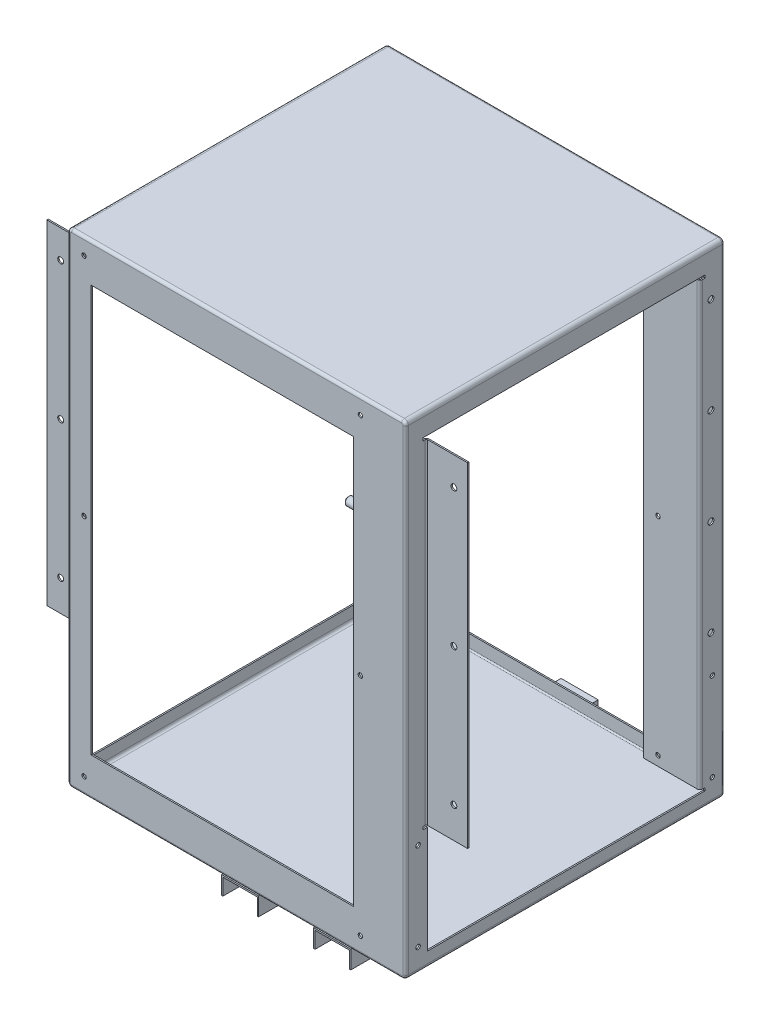
from build123d import *

# Parameters (mm, degrees)
EXTRUDE_1_DEPTH             = 232
SKETCH_2_W                  = 200
SKETCH_2_H                  = 325
CUT_EXTRUDE_1_DEPTH         = 500
EXTRUDE_START               = -1
EXTRUDE_1_2_DEPTH           = 1
SKETCH_4_W                  = 214
SKETCH_4_H                  = 325
EXTRUDE_2_DEPTH             = 1
FILLET_1_R                  = 1
FILLET_2_R                  = 2
SKETCH_5_R                  = 2.15
CUT_EXTRUDE_2_DEPTH         = 500
SKETCH_6_R                  = 3
EXTRUDE_3_DEPTH             = 20
CHAMFER_1_SIZE              = 1
SKETCH_7_R                  = 1.6
CUT_EXTRUDE_3_DEPTH         = 500
SKETCH_8_W                  = 191
SKETCH_8_H                  = 296
CUT_EXTRUDE_4_DEPTH         = 2
SKETCH_9_R                  = 1.6
CUT_EXTRUDE_5_DEPTH         = 2
EXTRUDE_6_REACH             = 396.406
EXTRUDE_6_DIRECTION_2_DEPTH = 15
SKETCH_11_W                 = 1
SKETCH_11_H                 = 243
EXTRUDE_7_DEPTH             = 30
SKETCH_12_W                 = 3.5
SKETCH_12_H                 = 2
CUT_EXTRUDE_6_DEPTH         = 20
SKETCH_13_W                 = 1
SKETCH_13_H                 = 243
EXTRUDE_8_DEPTH             = 30
SKETCH_14_R                 = 2.15
CUT_EXTRUDE_7_DEPTH         = 30
SKETCH_16_W                 = 1
SKETCH_16_H                 = 325
EXTRUDE_9_DEPTH             = 2
SKETCH_17_W                 = 1
SKETCH_17_H                 = 321
EXTRUDE_10_DEPTH            = 40
SKETCH_18_W                 = 1
SKETCH_18_H                 = 321
EXTRUDE_11_DEPTH            = 40
SKETCH_19_W                 = 3.5
SKETCH_19_H                 = 2
CUT_EXTRUDE_8_DEPTH         = 40
SKETCH_20_R                 = 1.6
CUT_EXTRUDE_9_DEPTH         = 10
SKETCH_21_R                 = 2.15
CUT_EXTRUDE_10_DEPTH        = 10
FILLET_3_R                  = 1
FILLET_4_R                  = 2
SKETCH_22_W                 = 4.75100146
SKETCH_22_H                 = 2.010828375
SKETCH_22_W_2               = 3.5
SKETCH_22_H_2               = 2
CUT_EXTRUDE_11_DEPTH        = 10


with BuildPart() as part:
    # Эскиз1 → Extrude 1 (new body)
    with BuildSketch(Plane.XY):
        with BuildLine():
            Line((123, -173), (123, 173))
            ThreePointArc((123, 173), (122.121320344, 175.121320344), (120, 176))
            Line((120, 176), (-120, 176))
            ThreePointArc((-120, 176), (-122.121320344, 175.121320344), (-123, 173))
            Line((-123, 173), (-123, -173))
            ThreePointArc((-123, -173), (-122.121320344, -175.121320344), (-120, -176))
            Line((-120, -176), (120, -176))
            ThreePointArc((120, -176), (122.121320344, -175.121320344), (123, -173))
        make_face()
        with BuildLine():
            Line((122, -173), (122, 173))
            ThreePointArc((122, 173), (121.414213562, 174.414213562), (120, 175))
            Line((120, 175), (-120, 175))
            ThreePointArc((-120, 175), (-121.414213562, 174.414213562), (-122, 173))
            Line((-122, 173), (-122, -173))
            ThreePointArc((-122, -173), (-121.414213562, -174.414213562), (-120, -175))
            Line((-120, -175), (120, -175))
            ThreePointArc((120, -175), (121.414213562, -174.414213562), (122, -173))
        make_face(mode=Mode.SUBTRACT)
    extrude(amount=EXTRUDE_1_DEPTH)

    # Эскиз2 → Вырез-Вытянуть1 (cut)
    with BuildSketch(Plane(origin=(123, 0, 0), x_dir=(0, 0, -1), z_dir=(1, 0, 0))):
        with Locations((-116, -2.5)):
            Rectangle(SKETCH_2_W, SKETCH_2_H)
    extrude(amount=-CUT_EXTRUDE_1_DEPTH, mode=Mode.SUBTRACT)

    # Эскиз3 → Extrude 1 2 (add)
    with BuildSketch(Plane.XY.offset(232).offset(EXTRUDE_START)):
        with BuildLine():
            Line((-123, 173), (-123, -173))
            ThreePointArc((-123, -173), (-122.121320344, -175.121320344), (-120, -176))
            Line((-120, -176), (120, -176))
            ThreePointArc((120, -176), (122.121320344, -175.121320344), (123, -173))
            Line((123, -173), (123, 173))
            ThreePointArc((123, 173), (122.121320344, 175.121320344), (120, 176))
            Line((120, 176), (-120, 176))
            ThreePointArc((-120, 176), (-122.121320344, 175.121320344), (-123, 173))
        make_face()
    extrude(amount=EXTRUDE_1_2_DEPTH)

    # Эскиз4 → Вытянуть2 (add)
    with BuildSketch(Plane(origin=(0, 0, 0), x_dir=(-1, 0, 0), z_dir=(0, 0, -1))):
        with BuildLine():
            Line((120, 176), (-120, 176))
            ThreePointArc((-120, 176), (-122.121320344, 175.121320344), (-123, 173))
            Line((-123, 173), (-123, -173))
            ThreePointArc((-123, -173), (-122.121320344, -175.121320344), (-120, -176))
            Line((-120, -176), (120, -176))
            ThreePointArc((120, -176), (122.121320344, -175.121320344), (123, -173))
            Line((123, -173), (123, 173))
            ThreePointArc((123, 173), (122.121320344, 175.121320344), (120, 176))
        make_face()
        with Locations((0, -2.5)):
            Rectangle(SKETCH_4_W, SKETCH_4_H, mode=Mode.SUBTRACT)
    extrude(amount=-EXTRUDE_2_DEPTH)

    # Скругление1
    fillet_1_edges = [part.edges().sort_by_distance(p)[0] for p in [
        (-122, 0, 1),
        (-121.414213562, 174.414213562, 1),
        (0, 175, 1),
        (121.414213562, 174.414213562, 1),
        (122, 0, 1),
        (121.414213562, -174.414213562, 1),
        (0, -175, 1),
        (-121.414213562, -174.414213562, 1),
        (0, 175, 231),
        (-121.414213562, 174.414213562, 231),
        (-122, 0, 231),
        (-121.414213562, -174.414213562, 231),
        (0, -175, 231),
        (121.414213562, -174.414213562, 231),
        (122, 0, 231),
        (121.414213562, 174.414213562, 231),
    ]]
    fillet(fillet_1_edges, radius=FILLET_1_R)

    # Скругление2
    fillet_2_edges = [part.edges().sort_by_distance(p)[0] for p in [
        (-122.121320344, -175.121320344, 232),
        (0, -176, 232),
        (122.121320344, -175.121320344, 232),
        (123, 0, 232),
        (122.121320344, 175.121320344, 232),
        (0, 176, 232),
        (-122.121320344, 175.121320344, 232),
        (0, 176, 0),
        (122.121320344, 175.121320344, 0),
        (123, 0, 0),
        (122.121320344, -175.121320344, 0),
        (0, -176, 0),
        (-122.121320344, -175.121320344, 0),
        (-123, 0, 0),
        (-122.121320344, 175.121320344, 0),
        (-123, 0, 232),
    ]]
    fillet(fillet_2_edges, radius=FILLET_2_R)

    # Эскиз5 → Вырез-Вытянуть2 (cut)
    with BuildSketch(Plane(origin=(123, 0, 0), x_dir=(0, 0, -1), z_dir=(1, 0, 0))):
        with Locations(Location((-10, 142.5, 0), (0, 0, 180))):
            Circle(SKETCH_5_R)
        with Locations(Location((-10, 72.5, 0), (0, 0, 180))):
            Circle(SKETCH_5_R)
        with Locations(Location((-10, 2.5, 0), (0, 0, 180))):
            Circle(SKETCH_5_R)
        with Locations(Location((-10, -67.5, 0), (0, 0, 180))):
            Circle(SKETCH_5_R)
    extrude(amount=-CUT_EXTRUDE_2_DEPTH, mode=Mode.SUBTRACT)

    # Эскиз6 → Вытянуть3 (add)
    with BuildSketch(Plane.ZY.offset(123)):
        with Locations(Location((8, -118, 0), (0, 0, 180))):
            Circle(SKETCH_6_R)
    extrude(amount=EXTRUDE_3_DEPTH)

    # Фаска1
    chamfer_1_edges = [part.edges().sort_by_distance(p)[0] for p in [
        (-143, -118, 11),
    ]]
    chamfer(chamfer_1_edges, length=CHAMFER_1_SIZE)

    # Эскиз7 → Вырез-Вытянуть3 (cut)
    with BuildSketch(Plane.ZY.offset(123)):
        with Locations((9, -95)):
            Circle(SKETCH_7_R)
        with Locations((9, -159)):
            Circle(SKETCH_7_R)
        with Locations((223, -95)):
            Circle(SKETCH_7_R)
        with Locations((223, -159)):
            Circle(SKETCH_7_R)
    extrude(amount=-CUT_EXTRUDE_3_DEPTH, mode=Mode.SUBTRACT)

    # Эскиз8 → Вырез-Вытянуть4 (cut)
    with BuildSketch(Plane.XY.offset(232)):
        with Locations((-10.5, 0)):
            Rectangle(SKETCH_8_W, SKETCH_8_H)
    extrude(amount=-CUT_EXTRUDE_4_DEPTH, mode=Mode.SUBTRACT)

    # Эскиз9 → Вырез-Вытянуть5 (cut)
    with BuildSketch(Plane.XY.offset(232)):
        with Locations((-111, 164)):
            Circle(SKETCH_9_R)
        with Locations((-111, 0)):
            Circle(SKETCH_9_R)
        with Locations((-111, -164)):
            Circle(SKETCH_9_R)
        with Locations((90, -164)):
            Circle(SKETCH_9_R)
        with Locations((90, 0)):
            Circle(SKETCH_9_R)
        with Locations((90, 164)):
            Circle(SKETCH_9_R)
    extrude(amount=-CUT_EXTRUDE_5_DEPTH, mode=Mode.SUBTRACT)

    # Вытянуть6: up to this face of the body (flat: up to its plane)
    extrude_6_end = Plane(part.part.faces().sort_by_distance((-117.709874725, -170.709874725, 232))[0])
    # Эскиз10 → Вытянуть6 (add, up to the picked face)
    with BuildSketch(Plane(origin=(123, 0, 0), x_dir=(1, 0, 0), z_dir=(0, 0, 1)), mode=Mode.PRIVATE) as extrude_6_sk1:
        Polygon((-134, -176.015230639), (-134, -175.815230639), (-107, -175.815230639), (-107, -176.015230639), (-107, -189.015230639), (-108, -189.015230639), (-108, -177.015230639), (-133, -177.015230639), (-133, -189.015230639), (-134, -189.015230639), align=None)
    extrude_6_tool1 = split(extrude(extrude_6_sk1.sketch, amount=EXTRUDE_6_REACH, mode=Mode.PRIVATE), bisect_by=extrude_6_end, keep=Keep.BOTH, mode=Mode.PRIVATE)
    # Эскиз10 → Вытянуть6 (add, up to the picked face)
    with BuildSketch(Plane(origin=(123, 0, 0), x_dir=(1, 0, 0), z_dir=(0, 0, 1)), mode=Mode.PRIVATE) as extrude_6_sk2:
        Polygon((-67, -176.015230639), (-67, -175.815230639), (-40, -175.815230639), (-40, -176.015230639), (-40, -189.015230639), (-41, -189.015230639), (-41, -177.015230639), (-66, -177.015230639), (-66, -189.015230639), (-67, -189.015230639), align=None)
    extrude_6_tool2 = split(extrude(extrude_6_sk2.sketch, amount=EXTRUDE_6_REACH, mode=Mode.PRIVATE), bisect_by=extrude_6_end, keep=Keep.BOTH, mode=Mode.PRIVATE)
    add(extrude_6_tool1.solids().sort_by(Axis((-10.69946, -175.915231, 0), (0, 0, 1)))[0])
    add(extrude_6_tool2.solids().sort_by(Axis((56.30054, -175.915231, 0), (0, 0, 1)))[0])

    # Эскиз10 → Вытянуть6 direction 2 (add)
    with BuildSketch(Plane(origin=(123, 0, 0), x_dir=(1, 0, 0), z_dir=(0, 0, 1))):
        Polygon((-134, -176.015230639), (-134, -175.815230639), (-107, -175.815230639), (-107, -176.015230639), (-107, -189.015230639), (-108, -189.015230639), (-108, -177.015230639), (-133, -177.015230639), (-133, -189.015230639), (-134, -189.015230639), align=None)
        Polygon((-67, -176.015230639), (-67, -175.815230639), (-40, -175.815230639), (-40, -176.015230639), (-40, -189.015230639), (-41, -189.015230639), (-41, -177.015230639), (-66, -177.015230639), (-66, -189.015230639), (-67, -189.015230639), align=None)
    extrude(amount=-EXTRUDE_6_DIRECTION_2_DEPTH)

    # Эскиз11 → Вытянуть7 (add)
    with BuildSketch(Plane(origin=(123, 0, 0), x_dir=(0, 0, -1), z_dir=(1, 0, 0))):
        with Locations((-216.5, 36.5)):
            Rectangle(SKETCH_11_W, SKETCH_11_H)
    extrude(amount=EXTRUDE_7_DEPTH)

    # Эскиз12 → Вырез-Вытянуть6 (cut)
    with BuildSketch(Plane(origin=(123, 0, 0), x_dir=(0, 0, -1), z_dir=(1, 0, 0))):
        with Locations((-217.75, 159)):
            Rectangle(SKETCH_12_W, SKETCH_12_H)
        with Locations((-217.75, -86)):
            Rectangle(SKETCH_12_W, SKETCH_12_H)
    extrude(amount=-CUT_EXTRUDE_6_DEPTH, mode=Mode.SUBTRACT)

    # Эскиз13 → Вытянуть8 (add)
    with BuildSketch(Plane.ZY.offset(123)):
        with Locations((216.5, 36.5)):
            Rectangle(SKETCH_13_W, SKETCH_13_H)
    extrude(amount=EXTRUDE_8_DEPTH)

    # Эскиз14 → Вырез-Вытянуть7 (cut)
    with BuildSketch(Plane(origin=(0, 0, 216), x_dir=(-1, 0, 0), z_dir=(0, 0, -1))):
        with Locations(Location((-143, 137.5, 0), (0, 0, 90))):
            Circle(SKETCH_14_R)
        with Locations(Location((-143, 37.5, 0), (0, 0, 90))):
            Circle(SKETCH_14_R)
        with Locations(Location((-143, -62.5, 0), (0, 0, 90))):
            Circle(SKETCH_14_R)
        with Locations(Location((143, -62.5, 0), (0, 0, 90))):
            Circle(SKETCH_14_R)
        with Locations(Location((143, 37.5, 0), (0, 0, 90))):
            Circle(SKETCH_14_R)
        with Locations(Location((143, 137.5, 0), (0, 0, 90))):
            Circle(SKETCH_14_R)
    extrude(amount=-CUT_EXTRUDE_7_DEPTH, mode=Mode.SUBTRACT)

    # Эскиз16 → Вытянуть9 (add)
    with BuildSketch(Plane.XY.offset(16)):
        with Locations((122.5, -2.5)):
            Rectangle(SKETCH_16_W, SKETCH_16_H)
        with Locations((-122.5, -2.5)):
            Rectangle(SKETCH_16_W, SKETCH_16_H)
    extrude(amount=EXTRUDE_9_DEPTH)

    # Эскиз17 → Вытянуть10 (add)
    with BuildSketch(Plane.ZY.offset(-122)):
        with Locations((17.5, -2.5)):
            Rectangle(SKETCH_17_W, SKETCH_17_H)
    extrude(amount=EXTRUDE_10_DEPTH)

    # Эскиз18 → Вытянуть11 (add)
    with BuildSketch(Plane(origin=(-122, 0, 0), x_dir=(0, 0, -1), z_dir=(1, 0, 0))):
        with Locations((-17.5, -2.5)):
            Rectangle(SKETCH_18_W, SKETCH_18_H)
    extrude(amount=EXTRUDE_11_DEPTH)

    # Эскиз19 → Вырез-Вытянуть8 (cut)
    with BuildSketch(Plane(origin=(-122, 0, 0), x_dir=(0, 0, -1), z_dir=(1, 0, 0))):
        with Locations((-16.25, -164)):
            Rectangle(SKETCH_19_W, SKETCH_19_H)
        with Locations((-16.25, 159)):
            Rectangle(SKETCH_19_W, SKETCH_19_H)
        with Locations((-217.75, -86)):
            Rectangle(SKETCH_19_W, SKETCH_19_H)
        with Locations((-217.75, 159)):
            Rectangle(SKETCH_19_W, SKETCH_19_H)
    extrude(amount=-CUT_EXTRUDE_8_DEPTH, mode=Mode.SUBTRACT)

    # Эскиз20 → Вырез-Вытянуть9 (cut)
    with BuildSketch(Plane(origin=(0, 0, 17), x_dir=(-1, 0, 0), z_dir=(0, 0, -1))):
        with Locations((-92.5, 145.5)):
            Circle(SKETCH_20_R)
        with Locations((-92.5, -5.25)):
            Circle(SKETCH_20_R)
        with Locations((-92.5, -156)):
            Circle(SKETCH_20_R)
        with Locations(Location((92.5, -156, 0), (0, 0, 180))):
            Circle(SKETCH_20_R)
        with Locations(Location((92.5, -5.25, 0), (0, 0, 180))):
            Circle(SKETCH_20_R)
        with Locations(Location((92.5, 145.5, 0), (0, 0, 180))):
            Circle(SKETCH_20_R)
    extrude(amount=-CUT_EXTRUDE_9_DEPTH, mode=Mode.SUBTRACT)

    # Эскиз21 → Вырез-Вытянуть10 (cut)
    with BuildSketch(Plane(origin=(0, 0, 17), x_dir=(-1, 0, 0), z_dir=(0, 0, -1))):
        with Locations(Location((92, 110.7, 0), (0, 0, 90))):
            Circle(SKETCH_21_R)
        with Locations(Location((92, 84.7, 0), (0, 0, 90))):
            Circle(SKETCH_21_R)
    extrude(amount=-CUT_EXTRUDE_10_DEPTH, mode=Mode.SUBTRACT)

    # Скругление3
    fillet_3_edges = [part.edges().sort_by_distance(p)[0] for p in [
        (123, 36.5, 217),
        (-123, 36.5, 217),
        (122, -2.5, 17),
        (-122, -2.5, 17),
    ]]
    fillet(fillet_3_edges, radius=FILLET_3_R)

    # Скругление4
    # the kernel refuses this fillet: 2 mm, written as the material it takes off along each edge
    with BuildSketch(Plane(origin=(122, -85, 216), x_dir=(1, 0, 0), z_dir=(0, 1, 0))) as fillet_4_piece_1:
        with BuildLine():
            CenterArc((FILLET_4_R, -FILLET_4_R), FILLET_4_R, 90, 90)
            Line((0, -FILLET_4_R), (0, 0))
            Line((0, 0), (FILLET_4_R, 0))
        make_face()
    extrude(amount=243, mode=Mode.SUBTRACT)
    with BuildSketch(Plane(origin=(123, -165, 18), x_dir=(0, 0, -1), z_dir=(0, 1, 0))) as fillet_4_piece_2:
        with BuildLine():
            CenterArc((FILLET_4_R, FILLET_4_R), FILLET_4_R, 180, 90)
            Line((0, FILLET_4_R), (0, 0))
            Line((0, 0), (FILLET_4_R, 0))
        make_face()
    extrude(amount=325, mode=Mode.SUBTRACT)
    with BuildSketch(Plane(origin=(-123, 163, 18), x_dir=(0, 0, -1), z_dir=(0, -1, 0))) as fillet_4_piece_3_section:
        with BuildLine():
            CenterArc((FILLET_4_R, FILLET_4_R), FILLET_4_R, 180, 90)
            Line((0, FILLET_4_R), (0, 0))
            Line((0, 0), (FILLET_4_R, 0))
        make_face()
    fillet_4_piece_3 = extrude(amount=331, mode=Mode.PRIVATE)
    fillet_4_piece_3 = split(fillet_4_piece_3, bisect_by=Plane(origin=(-122.64320814, -165, 17.511950301), z_dir=(0, 1, 0)), keep=Keep.TOP, mode=Mode.PRIVATE)
    fillet_4_piece_3 = split(fillet_4_piece_3, bisect_by=Plane(origin=(-122.64320814, 160, 17.511950301), z_dir=(0, -1, 0)), keep=Keep.TOP, mode=Mode.PRIVATE)
    add(fillet_4_piece_3, mode=Mode.SUBTRACT)
    with BuildSketch(Plane(origin=(-122, 158, 216), x_dir=(0, 0, 1), z_dir=(0, -1, 0))) as fillet_4_piece_4:
        with BuildLine():
            CenterArc((FILLET_4_R, FILLET_4_R), FILLET_4_R, 180, 90)
            Line((0, FILLET_4_R), (0, 0))
            Line((0, 0), (FILLET_4_R, 0))
        make_face()
    extrude(amount=243, mode=Mode.SUBTRACT)

    # Эскиз22 → Вырез-Вытянуть11 (cut)
    with BuildSketch(Plane.ZY.offset(-122)):
        with Locations((16.87550073, -163.994585813)):
            Rectangle(SKETCH_22_W, SKETCH_22_H)
        with Locations((15.982050808, 159)):
            Rectangle(SKETCH_22_W_2, SKETCH_22_H_2)
    extrude(amount=-CUT_EXTRUDE_11_DEPTH, mode=Mode.SUBTRACT)


solid = part.part
